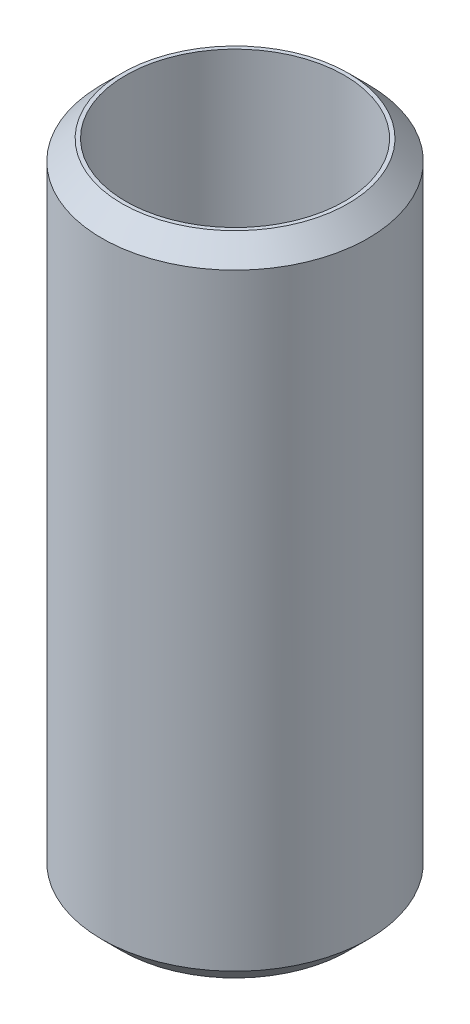
from build123d import *

# Parameters (mm, degrees)
SKETCH1_R           = 30
BOSS_EXTRUDE1_DEPTH = 145.825052308
SKETCH2_R           = 24.625997988
CUT_EXTRUDE1_DEPTH  = 152.871478167
CHAMFER1_SIZE       = 4.513285804


with BuildPart() as part:
    # Sketch1 → Boss-Extrude1 (new body)
    with BuildSketch(Plane(origin=(0, 0, 0), x_dir=(1, 0, 0), z_dir=(0, 1, 0))):
        Circle(SKETCH1_R)
    extrude(amount=BOSS_EXTRUDE1_DEPTH)

    # Sketch2 → Cut-Extrude1 (cut, through all)
    with BuildSketch(Plane(origin=(0, 0, 0), x_dir=(1, 0, 0), z_dir=(0, 1, 0))):
        Circle(SKETCH2_R)
    extrude(amount=CUT_EXTRUDE1_DEPTH, mode=Mode.SUBTRACT)

    # Chamfer1
    chamfer1_edges = [part.edges().sort_by_distance(p)[0] for p in [
        (-30, 145.825052308, 0),
        (-30, 0, 0),
    ]]
    chamfer(chamfer1_edges, length=CHAMFER1_SIZE)


solid = part.part
